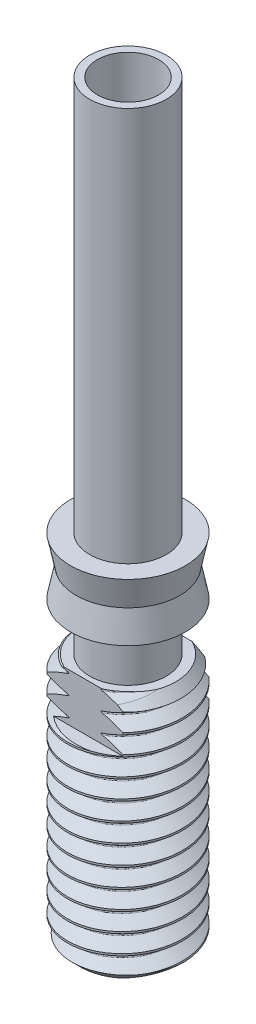
from build123d import *

# Parameters (mm, degrees)
CUT_SWEEP1_PITCH    = 1
SKETCH4_OUTSIDE_W   = 15.982
SKETCH4_OUTSIDE_H   = 15.982
SKETCH4_OUTSIDE_W_2 = 10.2375
SKETCH4_OUTSIDE_H_2 = 4.5
CUT_EXTRUDE1_DEPTH  = 2.5


with BuildPart() as part:
    # Sketch1 → Revolve1 (revolve)
    with BuildSketch(Plane.XY, mode=Mode.PRIVATE) as revolve1_sk:
        Polygon((1.6, 0), (2.5, 0), (3, 0.5), (3, 12.4), (2.5, 12.9), (2, 12.9), (2, 15.4), (3, 15.4), (2.7, 16.9), (3, 18.4), (2, 18.4), (2, 39), (1.6, 39), align=None)
    revolve(revolve1_sk.sketch.rotate(Axis((0, 0, 0), (0, 1, 0)), 90), axis=Axis((0, 0, 0), (0, 1, 0)))

    # Cut-Sweep1: the profile of Sketch3 screwed along a right-hand helix of 13.5 turns, 8 arcs to a turn; built about Z, then put on its axis
    cut_sweep1_z = Axis((0, 0, 0), (0, 0, 1))
    cut_sweep1_corners = [(3, 0, 0), (3, 0.047679434, -0.898736152), (2.421139351, 0.026002757, -0.490140422), (2.4, 0.023839717, -0.449368076), (2.421139351, 0.021676677, -0.40859573)]
    with BuildLine(mode=Mode.PRIVATE) as cut_sweep1_profile:
        Line(cut_sweep1_corners[0], cut_sweep1_corners[1])
        Line(cut_sweep1_corners[1], cut_sweep1_corners[2])
        Line(cut_sweep1_corners[4], cut_sweep1_corners[0])
        ThreePointArc((2.421139351, 0.026002757, -0.490140422), (2.405598241, 0.025057597, -0.472324569), (2.4, 0.023839717, -0.449368076))
        ThreePointArc((2.4, 0.023839717, -0.449368076), (2.405598241, 0.022621837, -0.426411584), (2.421139351, 0.021676677, -0.40859573))
    cut_sweep1_cap = Face(cut_sweep1_profile.wire())
    cut_sweep1_arcs = [((2.421139351, 0.026002757, -0.490140422), (2.4, 0.025211149, -0.475218958), (2.4, 0.023839717, -0.449368076), (1, 0.888035185042416, 1)), ((2.4, 0.023839717, -0.449368076), (2.4, 0.022468285, -0.423517195), (2.421139351, 0.021676677, -0.40859573), (1, 0.888035185042416, 1))]  # start, shoulder, end, weights
    cut_sweep1_turn_angles = [0, 22.5, 45, 67.5, 90, 112.5, 135, 157.5, 180, 202.5, 225, 247.5, 270, 292.5, 315, 337.5, 360]
    cut_sweep1_turn_weights = [1, 0.9238795325112867, 1, 0.9238795325112867, 1, 0.9238795325112867, 1, 0.9238795325112867, 1, 0.9238795325112867, 1, 0.9238795325112867, 1, 0.9238795325112867, 1, 0.9238795325112867, 1]
    cut_sweep1_turn_rails = [Edge.make_bspline([Vector(p[0], p[1], 0).rotate(cut_sweep1_z, cut_sweep1_turn_angles[k]) / cut_sweep1_turn_weights[k] + Vector(0, 0, p[2] + CUT_SWEEP1_PITCH * cut_sweep1_turn_angles[k] / 360) for k in range(17)], [0, 0, 0, 1, 1, 2, 2, 3, 3, 4, 4, 5, 5, 6, 6, 7, 7, 8, 8, 8], 2, cut_sweep1_turn_weights) for p in cut_sweep1_corners]
    cut_sweep1_turn_sides = [*[Face.make_surface_from_curves(cut_sweep1_turn_rails[p[0]], cut_sweep1_turn_rails[p[1]]) for p in [(0, 1), (1, 2), (4, 0)]], *[Face.make_bezier_surface([[Vector(p[j][0], p[j][1], 0).rotate(cut_sweep1_z, cut_sweep1_turn_angles[2 * i + k]) / cut_sweep1_turn_weights[2 * i + k] + Vector(0, 0, p[j][2] + CUT_SWEEP1_PITCH * cut_sweep1_turn_angles[2 * i + k] / 360) for k in range(3)] for j in range(3)], [[p[3][j] * cut_sweep1_turn_weights[2 * i + k] for k in range(3)] for j in range(3)]) for p in cut_sweep1_arcs for i in range(8)]]
    cut_sweep1_last_angles = [4680, 4702.5, 4725, 4747.5, 4770, 4792.5, 4815, 4837.5, 4860]
    cut_sweep1_last_weights = [1, 0.9238795325112867, 1, 0.9238795325112867, 1, 0.9238795325112867, 1, 0.9238795325112442, 1]
    cut_sweep1_last_rails = [Edge.make_bspline([Vector(p[0], p[1], 0).rotate(cut_sweep1_z, cut_sweep1_last_angles[k]) / cut_sweep1_last_weights[k] + Vector(0, 0, p[2] + CUT_SWEEP1_PITCH * cut_sweep1_last_angles[k] / 360) for k in range(9)], [0, 0, 0, 1, 1, 2, 2, 3, 3, 4, 4, 4], 2, cut_sweep1_last_weights) for p in cut_sweep1_corners]
    cut_sweep1_last_sides = [*[Face.make_surface_from_curves(cut_sweep1_last_rails[p[0]], cut_sweep1_last_rails[p[1]]) for p in [(0, 1), (1, 2), (4, 0)]], *[Face.make_bezier_surface([[Vector(p[j][0], p[j][1], 0).rotate(cut_sweep1_z, cut_sweep1_last_angles[2 * i + k]) / cut_sweep1_last_weights[2 * i + k] + Vector(0, 0, p[j][2] + CUT_SWEEP1_PITCH * cut_sweep1_last_angles[2 * i + k] / 360) for k in range(3)] for j in range(3)], [[p[3][j] * cut_sweep1_last_weights[2 * i + k] for k in range(3)] for j in range(3)]) for p in cut_sweep1_arcs for i in range(4)]]
    cut_sweep1 = Plane(origin=(0, 0, 0), x_dir=(-1, 0, 0), z_dir=(0, 1, 0)) * Solid(Shell([*[p.moved(Location((0, 0, CUT_SWEEP1_PITCH * i))) for i in range(13) for p in cut_sweep1_turn_sides], *cut_sweep1_last_sides, cut_sweep1_cap, cut_sweep1_cap.rotate(cut_sweep1_z, 4860).moved(Location((0, 0, CUT_SWEEP1_PITCH * 4860 / 360)))]))
    add(cut_sweep1, mode=Mode.SUBTRACT)

    # Sketch4 outside → Cut-Extrude1 (cut)
    with BuildSketch(Plane(origin=(0, 12.9, 0), x_dir=(1, 0, 0), z_dir=(0, 1, 0))):
        Rectangle(SKETCH4_OUTSIDE_W, SKETCH4_OUTSIDE_H)
        Rectangle(SKETCH4_OUTSIDE_W_2, SKETCH4_OUTSIDE_H_2, mode=Mode.SUBTRACT)
    extrude(amount=-CUT_EXTRUDE1_DEPTH, mode=Mode.SUBTRACT)


solid = part.part
